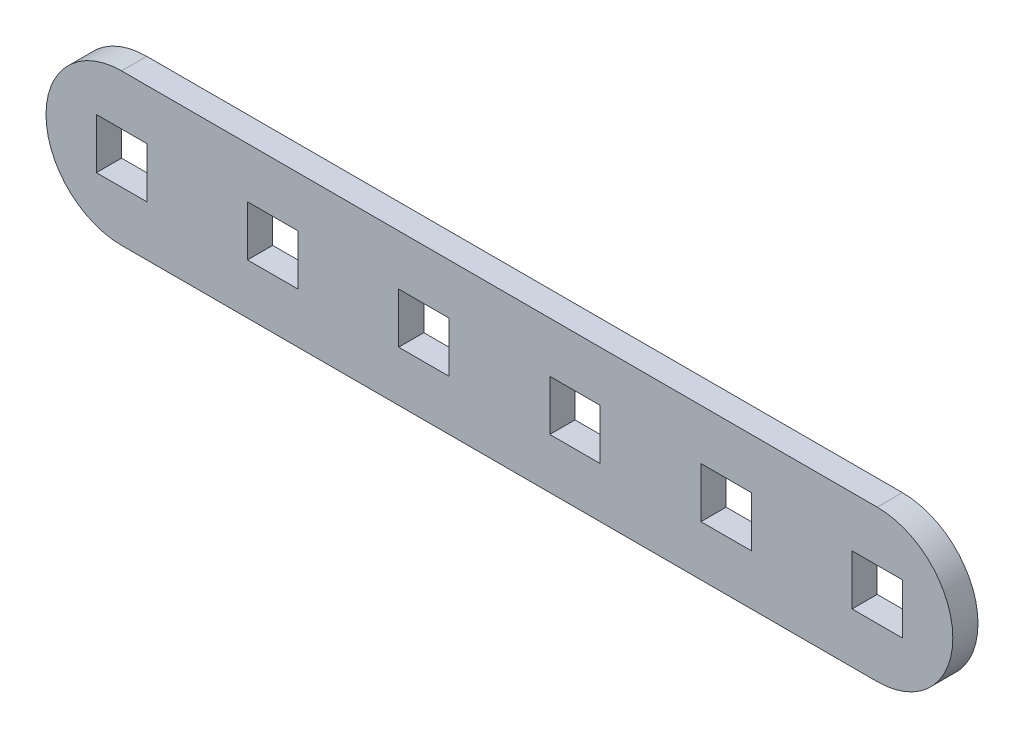
from build123d import *

# Parameters (mm, degrees)
MODEL_W                 = 3
MODEL_H                 = 3
SALIENTE_EXTRUIR1_DEPTH = 1.5


with BuildPart() as part:
    # Model → Saliente-Extruir1 (new body)
    with BuildSketch(Plane.XY):
        with BuildLine():
            Line((12.181222481, 298.136475095), (57.181222481, 298.136475095))
            ThreePointArc((57.181222481, 298.136475095), (61.681222481, 293.636475095), (57.181222481, 289.136475095))
            Line((57.181222481, 289.136475095), (12.181222481, 289.136475095))
            ThreePointArc((12.181222481, 289.136475095), (7.681222481, 293.636475095), (12.181222481, 298.136475095))
        make_face()
        with Locations((12.181222481, 293.636475095)):
            Rectangle(MODEL_W, MODEL_H, mode=Mode.SUBTRACT)
        with Locations((21.181222481, 293.636475095)):
            Rectangle(MODEL_W, MODEL_H, mode=Mode.SUBTRACT)
        with Locations((30.181222481, 293.636475095)):
            Rectangle(MODEL_W, MODEL_H, mode=Mode.SUBTRACT)
        with Locations((39.181222481, 293.636475095)):
            Rectangle(MODEL_W, MODEL_H, mode=Mode.SUBTRACT)
        with Locations((57.181222481, 293.636475095)):
            Rectangle(MODEL_W, MODEL_H, mode=Mode.SUBTRACT)
        with Locations((48.181222481, 293.636475095)):
            Rectangle(MODEL_W, MODEL_H, mode=Mode.SUBTRACT)
    extrude(amount=SALIENTE_EXTRUIR1_DEPTH)


solid = part.part
